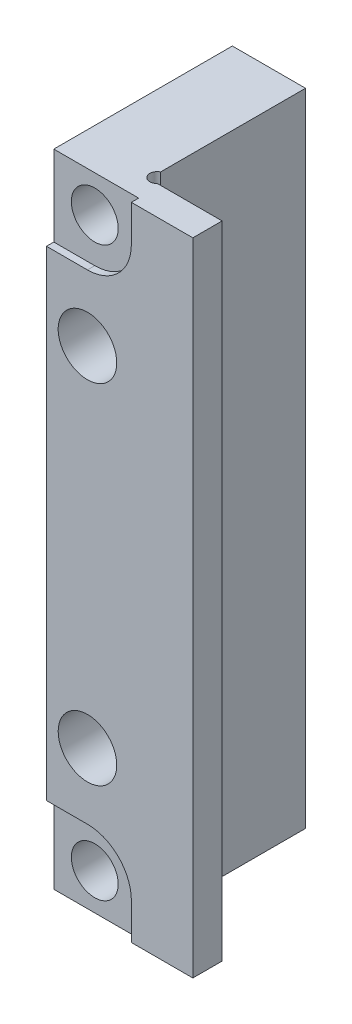
from build123d import *
from build123d.topology import SkipClean

# Parameters (mm, degrees)
SKETCH_1_W          = 10
SKETCH_1_H          = 43.8
EXTRUDE_1_DEPTH     = 10
CUT_EXTRUDE_1_DEPTH = 57.889805765
SKETCH_3_R          = 1.6
CUT_EXTRUDE_2_DEPTH = 43.398349024
SKETCH_4_R          = 2
CUT_EXTRUDE_3_DEPTH = 43.398349024
CUT_EXTRUDE_4_DEPTH = 0.5
SKETCH_6_W          = 5
SKETCH_6_H          = 43.8
SKETCH_6_R          = 1.6
SKETCH_6_R_2        = 2
EXTRUDE_2_DEPTH     = 2.7


with BuildPart() as part:
    # 草圖1 → 填料-伸長1 (new body)
    with BuildSketch(Plane.XY):
        with Locations((-29.9, 0)):
            Rectangle(SKETCH_1_W, SKETCH_1_H)
    extrude(amount=-EXTRUDE_1_DEPTH)

    # 草圖2 → 除料-伸長1 (cut, through all)
    with BuildSketch(Plane.XZ.offset(21.9)):
        with BuildLine():
            Line((-29.9, -10), (-24.9, -10))
            Line((-24.9, -10), (-24.9, -2))
            Line((-24.9, -2), (-29.322674139, -2))
            ThreePointArc((-29.322674139, -2), (-30.088835728, -2.052191426), (-29.9, -2.796549266))
            Line((-29.9, -2.796549266), (-29.9, -10))
        make_face()
    extrude(amount=-CUT_EXTRUDE_1_DEPTH, mode=Mode.SUBTRACT)

    # 草圖3 → 除料-伸長2 (cut, through all)
    with BuildSketch(Plane.XY):
        with Locations((-32.1, 19.4)):
            Circle(SKETCH_3_R)
        with Locations((-32.1, -19.4)):
            Circle(SKETCH_3_R)
    extrude(amount=-CUT_EXTRUDE_2_DEPTH, mode=Mode.SUBTRACT)

    # 草圖4 → 除料-伸長3 (cut, through all)
    with BuildSketch(Plane.XY):
        with Locations((-32.1, 11.9)):
            Circle(SKETCH_4_R)
        with Locations((-32.1, -11.9)):
            Circle(SKETCH_4_R)
    extrude(amount=-CUT_EXTRUDE_3_DEPTH, mode=Mode.SUBTRACT)

    # 草圖5 → 除料-伸長4 (cut)
    with BuildSketch(Plane.XY):
        with BuildLine():
            Line((-29.1, 19.4), (-29.1, 21.9))
            Line((-29.1, 21.9), (-34.9, 21.9))
            Line((-34.9, 21.9), (-34.9, 16.4))
            Line((-34.9, 16.4), (-32.1, 16.4))
            ThreePointArc((-32.1, 16.4), (-29.978679656, 17.278679656), (-29.1, 19.4))
        make_face()
        with BuildLine():
            Line((-29.1, -19.4), (-29.1, -21.9))
            Line((-29.1, -21.9), (-34.9, -21.9))
            Line((-34.9, -21.9), (-34.9, -16.4))
            Line((-34.9, -16.4), (-32.1, -16.4))
            ThreePointArc((-32.1, -16.4), (-29.978679656, -17.278679656), (-29.1, -19.4))
        make_face()
    extrude(amount=-CUT_EXTRUDE_4_DEPTH, mode=Mode.SUBTRACT)

    # 草圖6 → 填料-伸長2 (add)
    with SkipClean():  # the faces are left unmerged after this step: merging them gives an invalid solid
        with BuildSketch(Plane(origin=(0, 0, -10), x_dir=(-1, 0, 0), z_dir=(0, 0, -1))):
            with Locations((32.4, 0)):
                Rectangle(SKETCH_6_W, SKETCH_6_H)
            with Locations((32.1, 19.4)):
                Circle(SKETCH_6_R, mode=Mode.SUBTRACT)
            with Locations((32.1, 11.9)):
                Circle(SKETCH_6_R_2, mode=Mode.SUBTRACT)
            with Locations((32.1, -11.9)):
                Circle(SKETCH_6_R_2, mode=Mode.SUBTRACT)
            with Locations((32.1, -19.4)):
                Circle(SKETCH_6_R, mode=Mode.SUBTRACT)
        extrude(amount=EXTRUDE_2_DEPTH)


solid = part.part
